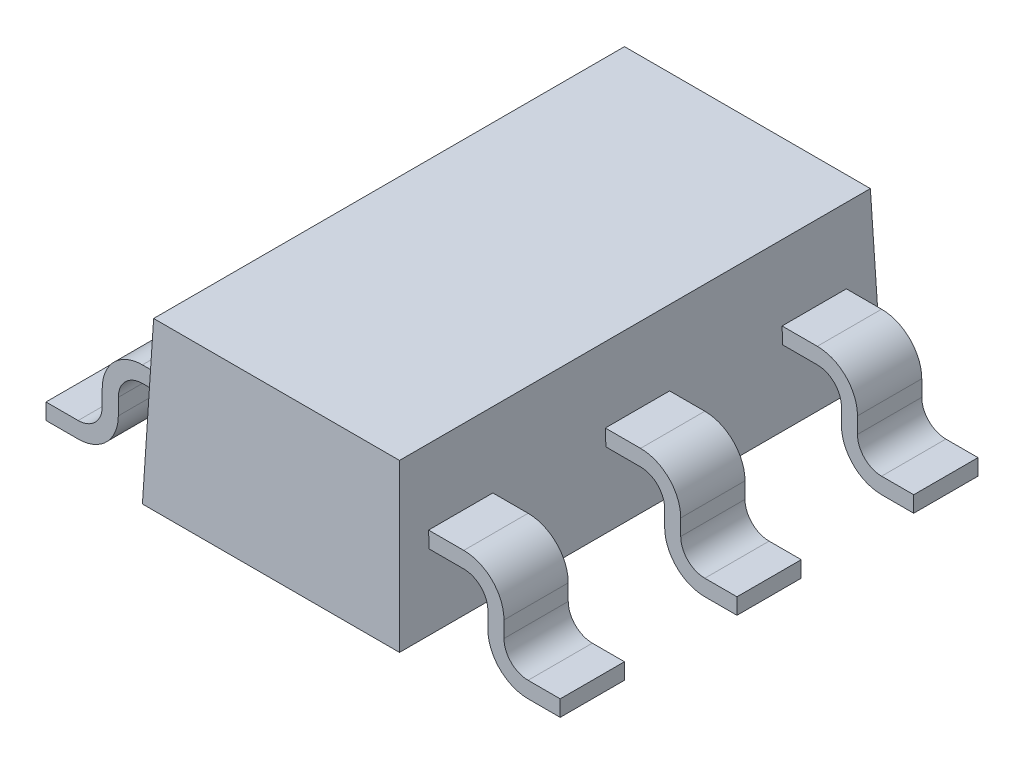
from build123d import *

# Parameters (mm, degrees)
BASES_W         = 1.6
BASES_H         = 3
BASE_DEPTH      = 0.5
LEG2_DEPTH      = 0.2
MIDDLELEG_DEPTH = 0.2
BODYDRAFT_ANGLE = -2
MIRROR1_START   = -1.3
MIRROR1_DEPTH   = 0.4
MIRROR1_START_2 = -0.2
MIRROR1_2_DEPTH = 0.4
MIRROR1_START_3 = 0.9
MIRROR1_3_DEPTH = 0.4


# Read off the part's stored shape, not the designer's step: Mirror1
with BuildPart() as part:
    # BaseS → Base (new, symmetric)
    with BuildSketch(Plane(origin=(0, 0, 0), x_dir=(1, 0, 0), z_dir=(0, 1, 0))):
        Rectangle(BASES_W, BASES_H)
    extrude(amount=BASE_DEPTH, both=True)

    # Leg2S → Leg2 (add, symmetric)
    with BuildSketch(Plane.XY.offset(1.1)):
        with BuildLine():
            Line((1.6, -0.45), (1.4, -0.45))
            ThreePointArc((1.4, -0.45), (1.293933983, -0.406066017), (1.25, -0.3))
            Line((1.25, -0.3), (1.25, -0.2))
            ThreePointArc((1.25, -0.2), (1.176776695, -0.023223305), (1, 0.05))
            Line((1, 0.05), (0.8, 0.05))
            Line((0.8, 0.05), (0.8, -0.05))
            Line((0.8, -0.05), (1, -0.05))
            ThreePointArc((1, -0.05), (1.106066017, -0.093933983), (1.15, -0.2))
            Line((1.15, -0.2), (1.15, -0.3))
            ThreePointArc((1.15, -0.3), (1.223223305, -0.476776695), (1.4, -0.55))
            Line((1.4, -0.55), (1.6, -0.55))
            Line((1.6, -0.55), (1.6, -0.45))
        make_face()
    leg2 = extrude(amount=LEG2_DEPTH, both=True)

    # Leg2M: Leg2 across plane
    add(leg2.mirror(Plane.XY))

    # MiddleLegS → MiddleLeg (add, symmetric)
    with BuildSketch(Plane.XY):
        with BuildLine():
            Line((1.6, -0.45), (1.4, -0.45))
            ThreePointArc((1.4, -0.45), (1.293933983, -0.406066017), (1.25, -0.3))
            Line((1.25, -0.3), (1.25, -0.2))
            ThreePointArc((1.25, -0.2), (1.176776695, -0.023223305), (1, 0.05))
            Line((1, 0.05), (0.8, 0.05))
            Line((0.8, 0.05), (0.8, -0.05))
            Line((0.8, -0.05), (1, -0.05))
            ThreePointArc((1, -0.05), (1.106066017, -0.093933983), (1.15, -0.2))
            Line((1.15, -0.2), (1.15, -0.3))
            ThreePointArc((1.15, -0.3), (1.223223305, -0.476776695), (1.4, -0.55))
            Line((1.4, -0.55), (1.6, -0.55))
            Line((1.6, -0.55), (1.6, -0.45))
        make_face()
    extrude(amount=MIDDLELEG_DEPTH, both=True)

    # BodyDraft
    bodydraft_faces = [part.faces().sort_by_distance(p)[0] for p in [
        (0.8, -0.468377223, 0),
        (0, 0, -1.5),
        (-0.8, 0, 0),
        (0, 0, 1.5),
    ]]
    draft(bodydraft_faces, Plane(origin=(0, -0.5, 0), x_dir=(0, 0, -1), z_dir=(0, -1, 0)), BODYDRAFT_ANGLE)

    # Mirror1 outline → Mirror1 (add)
    with BuildSketch(Plane.XY.offset(MIRROR1_START)):
        with BuildLine():
            Line((-1.6, -0.55), (-1.4, -0.55))
            ThreePointArc((-1.4, -0.55), (-1.223223305, -0.476776695), (-1.15, -0.3))
            Line((-1.15, -0.3), (-1.15, -0.2))
            ThreePointArc((-1.15, -0.2), (-1.106066017, -0.093933983), (-1, -0.05))
            Line((-1, -0.05), (-0.784285654, -0.05))
            Line((-0.784285654, -0.05), (-0.780793577, 0.05))
            Line((-0.780793577, 0.05), (-1, 0.05))
            ThreePointArc((-1, 0.05), (-1.176776695, -0.023223305), (-1.25, -0.2))
            Line((-1.25, -0.2), (-1.25, -0.3))
            ThreePointArc((-1.25, -0.3), (-1.293933983, -0.406066017), (-1.4, -0.45))
            Line((-1.4, -0.45), (-1.6, -0.45))
            Line((-1.6, -0.45), (-1.6, -0.55))
        make_face()
    extrude(amount=MIRROR1_DEPTH)

    # Mirror1 2 outline → Mirror1 2 (add)
    with BuildSketch(Plane.XY.offset(MIRROR1_START_2)):
        with BuildLine():
            Line((-1.6, -0.55), (-1.4, -0.55))
            ThreePointArc((-1.4, -0.55), (-1.223223305, -0.476776695), (-1.15, -0.3))
            Line((-1.15, -0.3), (-1.15, -0.2))
            ThreePointArc((-1.15, -0.2), (-1.106066017, -0.093933983), (-1, -0.05))
            Line((-1, -0.05), (-0.784285654, -0.05))
            Line((-0.784285654, -0.05), (-0.780793577, 0.05))
            Line((-0.780793577, 0.05), (-1, 0.05))
            ThreePointArc((-1, 0.05), (-1.176776695, -0.023223305), (-1.25, -0.2))
            Line((-1.25, -0.2), (-1.25, -0.3))
            ThreePointArc((-1.25, -0.3), (-1.293933983, -0.406066017), (-1.4, -0.45))
            Line((-1.4, -0.45), (-1.6, -0.45))
            Line((-1.6, -0.45), (-1.6, -0.55))
        make_face()
    extrude(amount=MIRROR1_2_DEPTH)

    # Mirror1 3 outline → Mirror1 3 (add)
    with BuildSketch(Plane.XY.offset(MIRROR1_START_3)):
        with BuildLine():
            Line((-1.6, -0.55), (-1.4, -0.55))
            ThreePointArc((-1.4, -0.55), (-1.223223305, -0.476776695), (-1.15, -0.3))
            Line((-1.15, -0.3), (-1.15, -0.2))
            ThreePointArc((-1.15, -0.2), (-1.106066017, -0.093933983), (-1, -0.05))
            Line((-1, -0.05), (-0.784285654, -0.05))
            Line((-0.784285654, -0.05), (-0.780793577, 0.05))
            Line((-0.780793577, 0.05), (-1, 0.05))
            ThreePointArc((-1, 0.05), (-1.176776695, -0.023223305), (-1.25, -0.2))
            Line((-1.25, -0.2), (-1.25, -0.3))
            ThreePointArc((-1.25, -0.3), (-1.293933983, -0.406066017), (-1.4, -0.45))
            Line((-1.4, -0.45), (-1.6, -0.45))
            Line((-1.6, -0.45), (-1.6, -0.55))
        make_face()
    extrude(amount=MIRROR1_3_DEPTH)


solid = part.part
